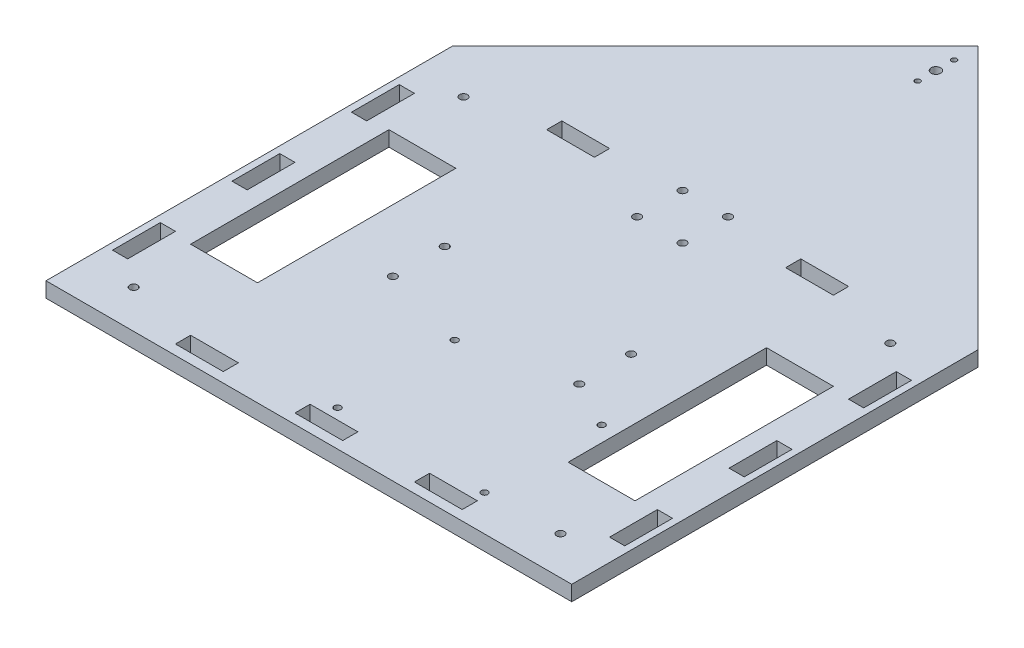
from build123d import *

# Parameters (mm, degrees)
SKETCH1_R           = 1.65
SKETCH1_R_2         = 1.1
SKETCH1_R_3         = 1.4
SKETCH1_R_4         = 2
SKETCH1_W           = 28
SKETCH1_H           = 83
SKETCH1_W_2         = 6.35
SKETCH1_H_2         = 20
SKETCH1_W_3         = 20
SKETCH1_H_3         = 6.35
BOSS_EXTRUDE1_DEPTH = 6.35


with BuildPart() as part:
    # Sketch1 → Boss-Extrude1 (new body)
    with BuildSketch(Plane(origin=(0, 0, 0), x_dir=(1, 0, 0), z_dir=(0, 1, 0))):
        Polygon((-110, 85), (0, 195), (110, 85), (110, -85), (-110, -85), align=None)
        with Locations((-39, 10.85)):
            Circle(SKETCH1_R, mode=Mode.SUBTRACT)
        with Locations((-39, -10.85)):
            Circle(SKETCH1_R, mode=Mode.SUBTRACT)
        with Locations((-89.294117647, -69)):
            Circle(SKETCH1_R, mode=Mode.SUBTRACT)
        with Locations((89.294117647, -69)):
            Circle(SKETCH1_R, mode=Mode.SUBTRACT)
        with Locations((-89.294117647, 69)):
            Circle(SKETCH1_R, mode=Mode.SUBTRACT)
        with Locations((89.294117647, 69)):
            Circle(SKETCH1_R, mode=Mode.SUBTRACT)
        with Locations((39, -10.85)):
            Circle(SKETCH1_R, mode=Mode.SUBTRACT)
        with Locations((39, 10.85)):
            Circle(SKETCH1_R, mode=Mode.SUBTRACT)
        with Locations((0, 185)):
            Circle(SKETCH1_R_2, mode=Mode.SUBTRACT)
        with Locations((0, 169.75)):
            Circle(SKETCH1_R_2, mode=Mode.SUBTRACT)
        with Locations((-3, -21)):
            Circle(SKETCH1_R_3, mode=Mode.SUBTRACT)
        with Locations((-3, -70)):
            Circle(SKETCH1_R_3, mode=Mode.SUBTRACT)
        with Locations((58.5, -70)):
            Circle(SKETCH1_R_3, mode=Mode.SUBTRACT)
        with Locations((58.5, -21)):
            Circle(SKETCH1_R_3, mode=Mode.SUBTRACT)
        with Locations((-9.5, 80.875)):
            Circle(SKETCH1_R, mode=Mode.SUBTRACT)
        with Locations((9.5, 80.875)):
            Circle(SKETCH1_R, mode=Mode.SUBTRACT)
        with Locations((9.5, 61.875)):
            Circle(SKETCH1_R, mode=Mode.SUBTRACT)
        with Locations((-9.5, 61.875)):
            Circle(SKETCH1_R, mode=Mode.SUBTRACT)
        with Locations((0, 177.375)):
            Circle(SKETCH1_R_4, mode=Mode.SUBTRACT)
        with Locations((-79, 0)):
            Rectangle(SKETCH1_W, SKETCH1_H, mode=Mode.SUBTRACT)
        with Locations((-104, 50)):
            Rectangle(SKETCH1_W_2, SKETCH1_H_2, mode=Mode.SUBTRACT)
        with Locations((-104, 0)):
            Rectangle(SKETCH1_W_2, SKETCH1_H_2, mode=Mode.SUBTRACT)
        with Locations((-104, -50)):
            Rectangle(SKETCH1_W_2, SKETCH1_H_2, mode=Mode.SUBTRACT)
        with Locations((50, -77.667136592)):
            Rectangle(SKETCH1_W_3, SKETCH1_H_3, mode=Mode.SUBTRACT)
        with Locations((0, -77.667136592)):
            Rectangle(SKETCH1_W_3, SKETCH1_H_3, mode=Mode.SUBTRACT)
        with Locations((-50, -77.667136592)):
            Rectangle(SKETCH1_W_3, SKETCH1_H_3, mode=Mode.SUBTRACT)
        with Locations((104, -50)):
            Rectangle(SKETCH1_W_2, SKETCH1_H_2, mode=Mode.SUBTRACT)
        with Locations((104, 50)):
            Rectangle(SKETCH1_W_2, SKETCH1_H_2, mode=Mode.SUBTRACT)
        with Locations((104, 0)):
            Rectangle(SKETCH1_W_2, SKETCH1_H_2, mode=Mode.SUBTRACT)
        with Locations((-50, 77.667136592)):
            Rectangle(SKETCH1_W_3, SKETCH1_H_3, mode=Mode.SUBTRACT)
        with Locations((50, 77.667136592)):
            Rectangle(SKETCH1_W_3, SKETCH1_H_3, mode=Mode.SUBTRACT)
        with Locations((79, 0)):
            Rectangle(SKETCH1_W, SKETCH1_H, mode=Mode.SUBTRACT)
    extrude(amount=BOSS_EXTRUDE1_DEPTH)


solid = part.part
